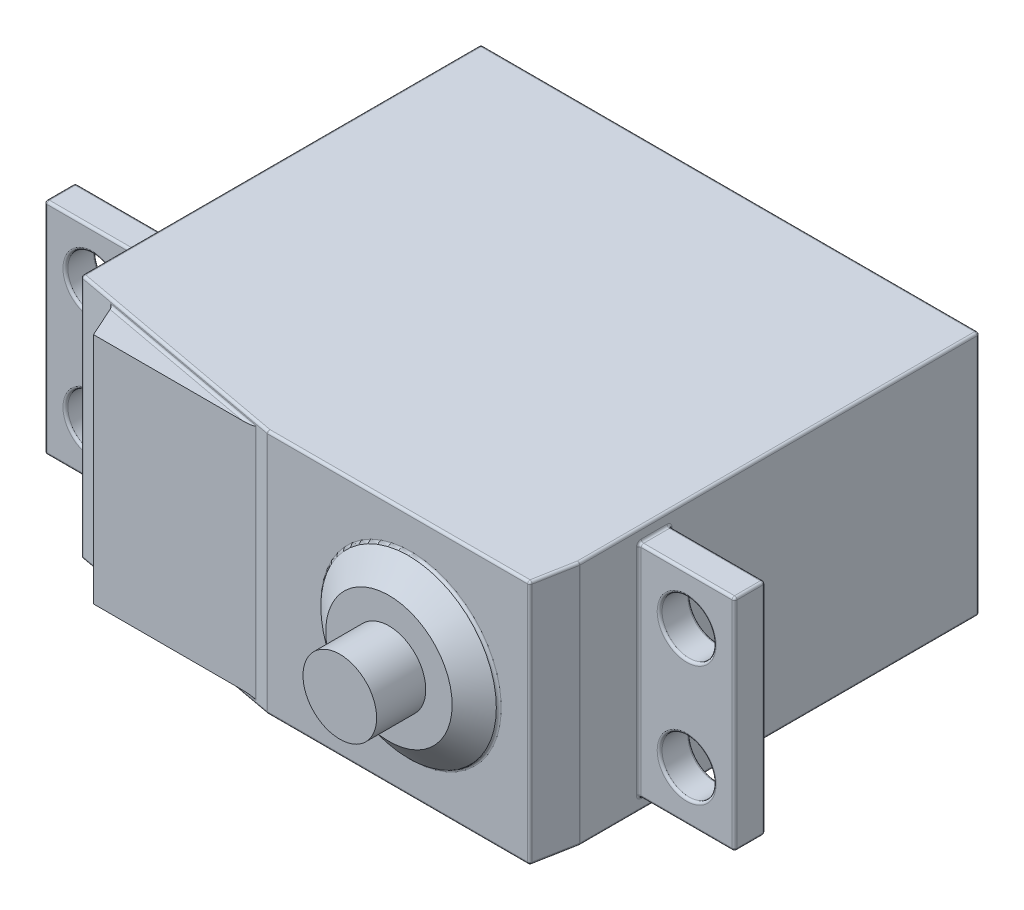
from build123d import *

# Parameters (mm, degrees)
EXTRUDE1_DEPTH = 10
SKETCH2_W      = 56.2
SKETCH2_H      = 2.5
EXTRUDE2_DEPTH = 8.95
SKETCH3_R      = 7.15
EXTRUDE3_DEPTH = 1.8
SKETCH4_R      = 3
EXTRUDE4_DEPTH = 4
CHAMFER1_SIZE  = 1.6
CHAMFER1_SIZE2 = 2
EXTRUDE5_DEPTH = 9.5
SKETCH6_R      = 2.2
EXTRUDE6_DEPTH = 19
FILLET2_R      = 0.2


with BuildPart() as part:
    # Sketch1 → Extrude1 (new, symmetric)
    with BuildSketch(Plane(origin=(0, 0, 0), x_dir=(1, 0, 0), z_dir=(0, 1, 0))):
        Polygon((-11.7, 0), (9.66319971, 0), (10.3, 3.441581815), (10.3, 36), (-30.3, 36), (-30.3, 3.441581815), align=None)
    extrude(amount=EXTRUDE1_DEPTH, both=True)

    # Sketch2 → Extrude2 (add, symmetric)
    with BuildSketch(Plane(origin=(0, 0, 0), x_dir=(1, 0, 0), z_dir=(0, 1, 0))):
        with Locations((-10, 9.5)):
            Rectangle(SKETCH2_W, SKETCH2_H)
    extrude(amount=EXTRUDE2_DEPTH, both=True)

    # Sketch3 → Extrude3 (add)
    with BuildSketch(Plane.XY):
        with Locations(Location((0, 0, 0), (0, 0, 180))):
            Circle(SKETCH3_R)
    extrude(amount=EXTRUDE3_DEPTH)

    # Sketch4 → Extrude4 (add)
    with BuildSketch(Plane.XY.offset(1.8)):
        Circle(SKETCH4_R)
    extrude(amount=EXTRUDE4_DEPTH)

    # Chamfer1
    chamfer1_edges = [part.edges().sort_by_distance(p)[0] for p in [
        (7.15, 0, 1.8),
    ]]
    chamfer1_side = [part.faces().sort_by_distance(p)[0] for p in [
        (7.15, 0, 0.9),
    ]]
    chamfer(chamfer1_edges, length=CHAMFER1_SIZE, length2=CHAMFER1_SIZE2, reference=chamfer1_side[0])

    # Sketch5 → Extrude5 (add, symmetric)
    with BuildSketch(Plane(origin=(0, 0, 0), x_dir=(1, 0, 0), z_dir=(0, 1, 0))):
        Polygon((-28.393312248, 5.35341563), (-26.073161564, 0.211460059), (-8.26443739, 0.211460059), align=None)
    extrude(amount=EXTRUDE5_DEPTH, both=True)

    # Sketch6 → Extrude6 (cut)
    with BuildSketch(Plane.XY.offset(-8.25)):
        with Locations((14.2, 4.9)):
            Circle(SKETCH6_R)
        with Locations((14.2, -4.9)):
            Circle(SKETCH6_R)
        with Locations((-34.2, -4.9)):
            Circle(SKETCH6_R)
        with Locations((-34.2, 4.9)):
            Circle(SKETCH6_R)
    extrude(amount=-EXTRUDE6_DEPTH, mode=Mode.SUBTRACT)

    # Fillet2
    fillet2_edges = [part.edges().sort_by_distance(p)[0] for p in [
        (-10, 10, -36),
        (9.66319971, 0, 0),
        (-11.7, 0, 0),
        (-30.3, 0, -3.441581815),
        (-30.3, 0, -36),
        (10.3, 0, -36),
        (10.3, 0, -3.441581815),
        (-30.3, 10, -19.720790908),
        (-21, 10, -1.720790908),
        (-1.018400145, 10, 0),
        (-30.3, -8.95, -9.5),
        (-30.3, 0, -10.75),
        (-30.3, 0, -8.25),
        (-30.3, 8.95, -9.5),
        (10.3, 0, -8.25),
        (14.2, -8.95, -8.25),
        (-34.2, -8.95, -8.25),
        (-38.1, 0, -8.25),
        (14.2, -8.95, -10.75),
        (10.3, 0, -10.75),
        (18.1, 0, -10.75),
        (-34.2, -8.95, -10.75),
        (14.2, 8.95, -8.25),
        (18.1, 8.95, -9.5),
        (14.2, 8.95, -10.75),
        (-34.2, 8.95, -10.75),
        (-38.1, 8.95, -9.5),
        (-34.2, 8.95, -8.25),
        (10.3, -8.95, -9.5),
        (-38.1, -8.95, -9.5),
        (-38.1, 0, -10.75),
        (18.1, -8.95, -9.5),
        (18.1, 0, -8.25),
        (10.3, 8.95, -9.5),
        (9.981599855, 10, -1.720790908),
        (7.15, 0, 0),
        (-20.060607769, -9.5, -1.54697396),
        (-12.842834112, 0, -0.211460059),
        (-27.278381426, 0, -2.882487862),
        (-20.060607769, 9.5, -1.54697396),
        (-1.018400145, -10, 0),
        (-21, -10, -1.720790908),
        (-30.3, -10, -19.720790908),
        (10.3, 10, -19.720790908),
        (-10, -10, -36),
        (12, 4.9, -10.75),
        (12, 4.9, -8.25),
        (10.3, -10, -19.720790908),
        (12, -4.9, -10.75),
        (12, -4.9, -8.25),
        (9.981599855, -10, -1.720790908),
        (-36.4, -4.9, -10.75),
        (-36.4, -4.9, -8.25),
        (-36.4, 4.9, -10.75),
        (-36.4, 4.9, -8.25),
    ]]
    fillet(fillet2_edges, radius=FILLET2_R - 0.0001)  # a hair under: the kernel refuses the full size


solid = part.part
